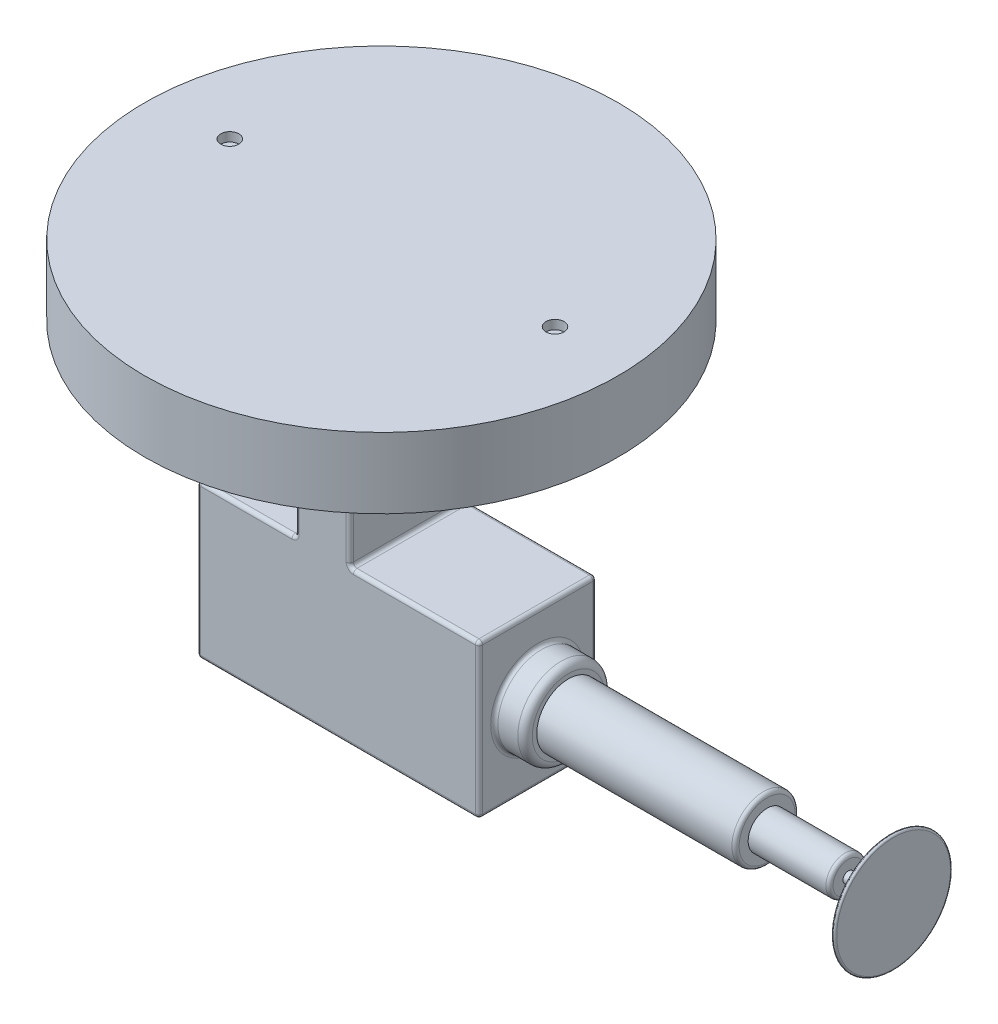
from build123d import *

# Parameters (mm, degrees)
SKETCH1_W            = 156
SKETCH1_H            = 65
BOSS_EXTRUDE1_DEPTH  = 85
SKETCH5_W            = 30
SKETCH5_H            = 65
BOSS_EXTRUDE4_DEPTH  = 95
SKETCH6_R            = 131
BOSS_EXTRUDE5_DEPTH  = 39
SKETCH7_R            = 5
CUT_EXTRUDE3_DEPTH   = 5
FILLET10_R           = 2
FILLET11_R           = 2
FILLET12_R           = 2
FILLET16_R           = 2
SKETCH2_R            = 24
BOSS_EXTRUDE6_DEPTH  = 17
SKETCH8_R            = 17.5
BOSS_EXTRUDE7_DEPTH  = 110
SKETCH9_R            = 10.5
BOSS_EXTRUDE8_DEPTH  = 45
SKETCH10_R           = 3
BOSS_EXTRUDE9_DEPTH  = 23
SKETCH11_R           = 32.5
BOSS_EXTRUDE10_DEPTH = 2
FILLET17_R           = 2
FILLET18_R           = 4
FILLET19_R           = 1


# Some blends are built 0.0001 mm under size
with BuildPart() as part:
    # Sketch1 → Boss-Extrude1 (new body)
    with BuildSketch(Plane(origin=(0, 0, 0), x_dir=(1, 0, 0), z_dir=(0, 1, 0))):
        with Locations((78, 32.5)):
            Rectangle(SKETCH1_W, SKETCH1_H)
    extrude(amount=BOSS_EXTRUDE1_DEPTH)

    # Sketch5 → Boss-Extrude4 (add)
    with BuildSketch(Plane(origin=(0, 85, 0), x_dir=(1, 0, 0), z_dir=(0, 1, 0))):
        with Locations((69.5, 32.5)):
            Rectangle(SKETCH5_W, SKETCH5_H)
    extrude(amount=BOSS_EXTRUDE4_DEPTH)

    # Sketch6 → Boss-Extrude5 (add)
    with BuildSketch(Plane(origin=(0, 180, 0), x_dir=(1, 0, 0), z_dir=(0, 1, 0))):
        with Locations(Location((69.5, 32.5, 0), (0, 0, 270))):
            Circle(SKETCH6_R)
    extrude(amount=BOSS_EXTRUDE5_DEPTH)

    # Sketch7 → Cut-Extrude3 (cut)
    with BuildSketch(Plane(origin=(0, 219, 0), x_dir=(-1, 0, 0), z_dir=(0, 1, 0))):
        with Locations(Location((20.5, -38.587995043, 0), (0, 0, 90))):
            Circle(SKETCH7_R)
        with Locations(Location((-159.5, -38.587995043, 0), (0, 0, 90))):
            Circle(SKETCH7_R)
    extrude(amount=-CUT_EXTRUDE3_DEPTH, mode=Mode.SUBTRACT)

    # Fillet10
    fillet10_edges = [part.edges().sort_by_distance(p)[0] for p in [
        (0, 42.5, 0),
    ]]
    fillet(fillet10_edges, radius=FILLET10_R)

    # Fillet11
    fillet11_edges = [part.edges().sort_by_distance(p)[0] for p in [
        (54.5, 132.5, -65),
        (54.5, 132.5, 0),
        (79, 0, 0),
        (54.5, 85, -32.5),
        (84.5, 85, -32.5),
        (0, 0, -33.5),
        (0, 85, -33.5),
        (28.25, 85, 0),
        (27.25, 85, -65),
        (0, 42.5, -65),
        (0.585786438, 0, -0.585786438),
        (0.585786438, 85, -0.585786438),
    ]]
    fillet(fillet11_edges, radius=FILLET11_R)

    # Fillet12
    # the kernel refuses this fillet: 2 mm, written as the material it takes off along each edge
    with BuildSketch(Plane(origin=(2, 2, -63), x_dir=(0, 0, -1), z_dir=(0, -1, 0))) as fillet12_piece_1_section:
        Polygon((0, 0), (FILLET12_R, 0), (FILLET12_R, -FILLET12_R), (0, -FILLET12_R), align=None)
    fillet12_piece_1 = extrude(amount=FILLET12_R, mode=Mode.PRIVATE)
    fillet12_piece_1 = fillet12_piece_1 - Plane(origin=(2, 2, -63), x_dir=(0.7071067811865475, 0, 0.7071067811865475), z_dir=(0, -1, 0)) * Sphere(FILLET12_R, mode=Mode.PRIVATE)
    add(fillet12_piece_1, mode=Mode.SUBTRACT)
    with BuildSketch(Plane(origin=(161, 85, -65), x_dir=(0, 0, 1), z_dir=(-1, 0, 0))) as fillet12_piece_2:
        with BuildLine():
            CenterArc((FILLET12_R, -FILLET12_R), FILLET12_R, 90, 90)
            Line((0, -FILLET12_R), (0, 0))
            Line((0, 0), (FILLET12_R, 0))
        make_face()
    extrude(amount=74.5, mode=Mode.SUBTRACT)
    with BuildSketch(Plane(origin=(84.5, 87, 0), x_dir=(-1, 0, 0), z_dir=(0, 1, 0)), Plane(origin=(84.5, 87, -65), x_dir=(0, 0, 1), z_dir=(0, 1, 0))) as fillet12_piece_3:
        with BuildLine():
            CenterArc((FILLET12_R, -FILLET12_R), FILLET12_R, 90, 90)
            Line((0, -FILLET12_R), (0, 0))
            Line((0, 0), (FILLET12_R, 0))
        make_face()
    extrude(amount=93, mode=Mode.SUBTRACT)
    with BuildSketch(Plane(origin=(161, 0, -65), x_dir=(0, 0, 1), z_dir=(-1, 0, 0))) as fillet12_piece_4:
        with BuildLine():
            CenterArc((FILLET12_R, FILLET12_R), FILLET12_R, 180, 90)
            Line((0, FILLET12_R), (0, 0))
            Line((0, 0), (FILLET12_R, 0))
        make_face()
    extrude(amount=159, mode=Mode.SUBTRACT)
    with BuildSketch(Plane(origin=(86.5, 85, 0), x_dir=(0, -1, 0), z_dir=(1, 0, 0))) as fillet12_piece_5:
        with BuildLine():
            CenterArc((FILLET12_R, FILLET12_R), FILLET12_R, 180, 90)
            Line((0, FILLET12_R), (0, 0))
            Line((0, 0), (FILLET12_R, 0))
        make_face()
    extrude(amount=74.5, mode=Mode.SUBTRACT)
    with BuildSketch(Plane(origin=(156, 0, -2), x_dir=(0, 1, 0), z_dir=(0, 0, -1))) as fillet12_piece_6:
        with BuildLine():
            CenterArc((FILLET12_R, -FILLET12_R), FILLET12_R, 90, 90)
            Line((0, -FILLET12_R), (0, 0))
            Line((0, 0), (FILLET12_R, 0))
        make_face()
    extrude(amount=68, mode=Mode.SUBTRACT)
    with BuildSketch(Plane(origin=(156, 2, -2), x_dir=(0, 0, 1), z_dir=(0, 1, 0))) as fillet12_piece_7:
        with BuildLine():
            CenterArc((2 - FILLET12_R, -FILLET12_R), FILLET12_R, 0, 90)
            Line((2 - FILLET12_R, 0), (2, 0))
            Line((2, 0), (2, -FILLET12_R))
        make_face()
    revolve(axis=Axis((156, 2, -2), (1, 0, 0)), revolution_arc=90, mode=Mode.SUBTRACT)
    with BuildSketch(Plane(origin=(86.5, 87, -65), x_dir=(-1, 0, 0), z_dir=(0, 1, 0))) as fillet12_piece_8:
        with BuildLine():
            CenterArc((2 + FILLET12_R, FILLET12_R), FILLET12_R, 180, 90)
            Line((2 + FILLET12_R, 0), (2, 0))
            Line((2, 0), (2, FILLET12_R))
        make_face()
    revolve(axis=Axis((86.5, 87, -65), (0, 0, 1)), revolution_arc=90, mode=Mode.SUBTRACT)
    with BuildSketch(Plane(origin=(86.5, 87, 0), x_dir=(-1, 0, 0), z_dir=(0, 1, 0))) as fillet12_piece_9:
        with BuildLine():
            CenterArc((2 + FILLET12_R, -FILLET12_R), FILLET12_R, 90, 90)
            Line((2, -FILLET12_R), (2, 0))
            Line((2, 0), (2 + FILLET12_R, 0))
        make_face()
    revolve(axis=Axis((86.5, 87, 0), (0, 0, 1)), revolution_arc=90, mode=Mode.SUBTRACT)
    with BuildSketch(Plane(origin=(156, 2, 0), x_dir=(-1, 0, 0), z_dir=(0, 1, 0))) as fillet12_piece_10:
        with BuildLine():
            CenterArc((FILLET12_R, -FILLET12_R), FILLET12_R, 90, 90)
            Line((0, -FILLET12_R), (0, 0))
            Line((0, 0), (FILLET12_R, 0))
        make_face()
    extrude(amount=88, mode=Mode.SUBTRACT)

    # Fillet16
    # the kernel refuses this fillet: 2 mm, written as the material it takes off along each edge
    with BuildSketch(Plane(origin=(154, 83, -2), x_dir=(0, 1, 0), z_dir=(1, 0, 0))) as fillet16_piece_1_section:
        Polygon((0, 0), (FILLET16_R, 0), (FILLET16_R, FILLET16_R), (0, FILLET16_R), align=None)
    fillet16_piece_1 = extrude(amount=FILLET16_R, mode=Mode.PRIVATE)
    fillet16_piece_1 = fillet16_piece_1 - Plane(origin=(154, 83, -2), x_dir=(0, -0.7071067811865475, -0.7071067811865475), z_dir=(1, 0, 0)) * Sphere(FILLET16_R, mode=Mode.PRIVATE)
    add(fillet16_piece_1, mode=Mode.SUBTRACT)
    with BuildSketch(Plane(origin=(154, 2, -63), x_dir=(0, 0, -1), z_dir=(1, 0, 0))) as fillet16_piece_2_section:
        Polygon((0, 0), (FILLET16_R, 0), (FILLET16_R, -FILLET16_R), (0, -FILLET16_R), align=None)
    fillet16_piece_2 = extrude(amount=FILLET16_R, mode=Mode.PRIVATE)
    fillet16_piece_2 = fillet16_piece_2 - Plane(origin=(154, 2, -63), x_dir=(0, 0.7071067811865475, 0.7071067811865475), z_dir=(1, 0, 0)) * Sphere(FILLET16_R, mode=Mode.PRIVATE)
    add(fillet16_piece_2, mode=Mode.SUBTRACT)
    with BuildSketch(Plane(origin=(156, 85, -2), x_dir=(0, -1, 0), z_dir=(0, 0, -1))) as fillet16_piece_3:
        with BuildLine():
            CenterArc((FILLET16_R, FILLET16_R), FILLET16_R, 180, 90)
            Line((0, FILLET16_R), (0, 0))
            Line((0, 0), (FILLET16_R, 0))
        make_face()
    extrude(amount=61, mode=Mode.SUBTRACT)
    with BuildSketch(Plane(origin=(156, 83, -63), x_dir=(0, 0, -1), z_dir=(0, -1, 0))) as fillet16_piece_4:
        with BuildLine():
            CenterArc((2 - FILLET16_R, -FILLET16_R), FILLET16_R, 0, 90)
            Line((2, -FILLET16_R), (2, 0))
            Line((2, 0), (2 - FILLET16_R, 0))
        make_face()
    revolve(axis=Axis((156, 83, -63), (1, 0, 0)), revolution_arc=90, mode=Mode.SUBTRACT)
    with BuildSketch(Plane(origin=(156, 2, -65), x_dir=(0, 0, 1), z_dir=(0, 1, 0))) as fillet16_piece_5:
        with BuildLine():
            CenterArc((FILLET16_R, -FILLET16_R), FILLET16_R, 90, 90)
            Line((0, -FILLET16_R), (0, 0))
            Line((0, 0), (FILLET16_R, 0))
        make_face()
    extrude(amount=81, mode=Mode.SUBTRACT)

    # Sketch2 → Boss-Extrude6 (add)
    with BuildSketch(Plane(origin=(156, 0, 0), x_dir=(0, 0, -1), z_dir=(1, 0, 0))):
        with Locations(Location((32.5, 42.5, 0), (0, 0, 180))):
            Circle(SKETCH2_R)
    extrude(amount=BOSS_EXTRUDE6_DEPTH)

    # Sketch8 → Boss-Extrude7 (add)
    with BuildSketch(Plane(origin=(173, 0, 0), x_dir=(0, 0, -1), z_dir=(1, 0, 0))):
        with Locations((32.5, 42.5)):
            Circle(SKETCH8_R)
    extrude(amount=BOSS_EXTRUDE7_DEPTH)

    # Sketch9 → Boss-Extrude8 (add)
    with BuildSketch(Plane(origin=(283, 0, 0), x_dir=(0, 0, -1), z_dir=(1, 0, 0))):
        with Locations(Location((32.5, 42.5, 0), (0, 0, 180))):
            Circle(SKETCH9_R)
    extrude(amount=BOSS_EXTRUDE8_DEPTH)

    # Sketch10 → Boss-Extrude9 (add)
    with BuildSketch(Plane(origin=(328, 0, 0), x_dir=(0, 0, -1), z_dir=(1, 0, 0))):
        with Locations((32.5, 42.5)):
            Circle(SKETCH10_R)
    extrude(amount=BOSS_EXTRUDE9_DEPTH)

    # Sketch11 → Boss-Extrude10 (add)
    with BuildSketch(Plane(origin=(351, 0, 0), x_dir=(0, 0, -1), z_dir=(1, 0, 0))):
        with Locations((32.5, 42.5)):
            Circle(SKETCH11_R)
    extrude(amount=BOSS_EXTRUDE10_DEPTH)

    # Fillet17
    fillet17_edges = [part.edges().sort_by_distance(p)[0] for p in [
        (156, 42.5, -56.5),
        (283, 42.5, -15),
        (328, 42.5, -43),
    ]]
    fillet(fillet17_edges, radius=FILLET17_R)

    # Fillet18
    fillet18_edges = [part.edges().sort_by_distance(p)[0] for p in [
        (173, 42.5, -56.5),
    ]]
    fillet(fillet18_edges, radius=FILLET18_R)

    # Fillet19
    fillet19_edges = [part.edges().sort_by_distance(p)[0] for p in [
        (351, 42.5, 0),
        (353, 42.5, 0),
    ]]
    fillet(fillet19_edges, radius=FILLET19_R - 0.0001)  # a hair under: the kernel refuses the full size


solid = part.part
